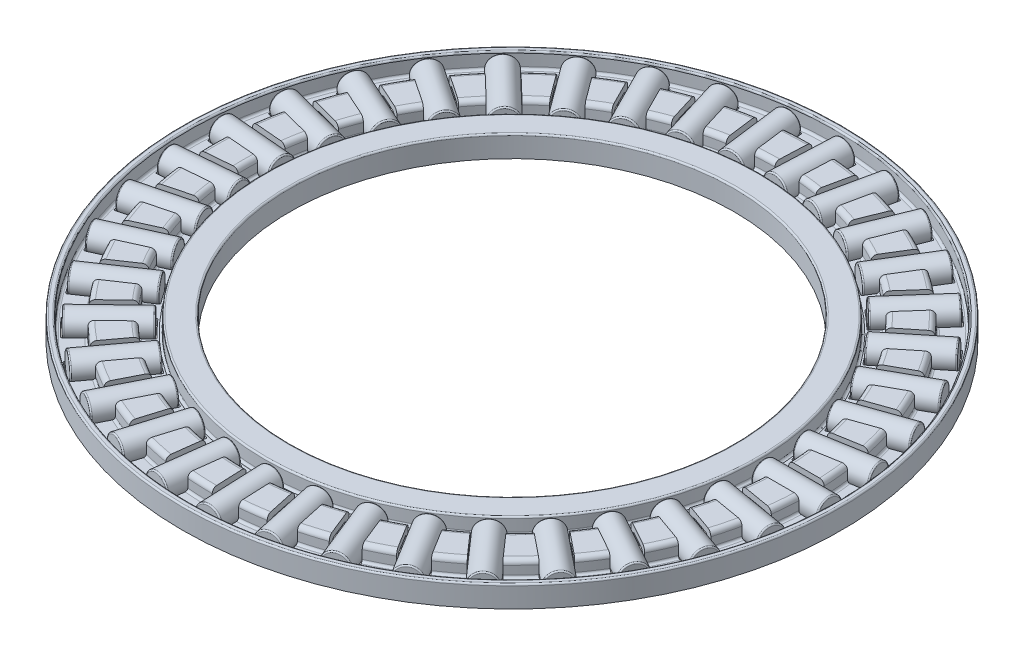
from build123d import *

# Parameters (mm, degrees)
FILLET1_R                = 0.369230769
FILLET2_R                = 0.369230769
FILLET3_R                = 0.125
FILLET4_R                = 0.184615385
CUT_EXTRUDE1_DEPTH       = 37.779376085
FILLET5_R                = 0.100026264
CIRPATTERN1_COUNT        = 37
FILLET5_OF_CIRPATTERN1_R = 0.100026264
SKETCH5_W                = 5.204168711
SKETCH5_H                = 1
FILLET6_R                = 0.100026264
CIRPATTERN2_COUNT        = 37


with BuildPart() as part:
    # Sketch3 → Revolve1 (revolve)
    with BuildSketch(Plane(origin=(0, 0, 0), x_dir=(0, 0, -1), z_dir=(1, 0, 0))):
        Polygon((18.183333333, -0.85), (18.183333333, 0.373397436), (18.841666667, 0.373397436), (18.841666667, -0.85), (21.331089744, -0.85), (21.331089744, 0.373397436), (23.17724359, 0.373397436), (23.17724359, -0.85), (25.666666667, -0.85), (25.666666667, 0.373397436), (25.833333333, 0.373397436), (25.833333333, -0.85), (26, -0.85), (26, 0.85), (25.5, 0.85), (25.5, -0.373397436), (23.653846154, -0.373397436), (23.653846154, 0.85), (20.854487179, 0.85), (20.854487179, -0.373397436), (19.5, -0.373397436), (19.5, 0.85), (17.525, 0.85), (17.525, -0.85), align=None)
    revolve(axis=Axis((0, 1, 0), (0, -1, 0)))

    # Fillet1
    fillet1_edges = [part.edges().sort_by_distance(p)[0] for p in [
        (0, -0.85, 23.17724359),
        (0, -0.85, 25.666666667),
        (0, -0.85, 18.841666667),
        (0, -0.85, 21.331089744),
    ]]
    fillet(fillet1_edges, radius=FILLET1_R)

    # Fillet2
    fillet2_edges = [part.edges().sort_by_distance(p)[0] for p in [
        (0, 0.85, 23.653846154),
        (0, 0.85, 20.854487179),
    ]]
    fillet(fillet2_edges, radius=FILLET2_R)

    # Fillet3
    fillet3_edges = [part.edges().sort_by_distance(p)[0] for p in [
        (0, 0.85, 25.5),
        (0, 0.85, 26),
        (0, 0.85, 19.5),
        (0, 0.85, 17.525),
    ]]
    fillet(fillet3_edges, radius=FILLET3_R)

    # Fillet4
    fillet4_edges = [part.edges().sort_by_distance(p)[0] for p in [
        (0, 0.373397436, 21.331089744),
        (0, 0.373397436, 23.17724359),
        (0, -0.373397436, 25.5),
        (0, -0.373397436, 23.653846154),
        (0, -0.373397436, 20.854487179),
        (0, -0.373397436, 19.5),
    ]]
    fillet(fillet4_edges, radius=FILLET4_R)

    # Sketch4 → Cut-Extrude1 (cut, symmetric)
    with BuildSketch(Plane(origin=(0, 0, 0), x_dir=(1, 0, 0), z_dir=(0, 1, 0))):
        with BuildLine():
            Line((19.774731351, 1), (25.180150913, 1))
            ThreePointArc((25.180150913, 1), (25.2, 0), (25.180150913, -1))
            Line((25.180150913, -1), (19.774731351, -1))
            ThreePointArc((19.774731351, -1), (19.8, 0), (19.774731351, 1))
        make_face()
    cut_extrude1 = extrude(amount=CUT_EXTRUDE1_DEPTH, both=True, mode=Mode.SUBTRACT)

    # Fillet5
    fillet5_edges = [part.edges().sort_by_distance(p)[0] for p in [
        (25.180150913, -0.611698718, -1),
        (25.180150913, -0.611698718, 1),
        (19.774731351, -0.611698718, -1),
        (19.774731351, -0.611698718, 1),
    ]]
    fillet(fillet5_edges, radius=FILLET5_R)

    # CirPattern1: Cut-Extrude1 ×37 about axis
    cirpattern1_axis = Axis((0, 1, 0), (0, -1, 0))
    for i in range(1, CIRPATTERN1_COUNT):
        add(cut_extrude1.rotate(cirpattern1_axis, i * 360 / CIRPATTERN1_COUNT), mode=Mode.SUBTRACT)

    # Fillet5 of CirPattern1
    fillet5_of_cirpattern1_edges = [part.edges().sort_by_distance(p)[0] for p in [
        (24.986958185, -0.611698718, 3.26985025),
        (24.648956544, -0.611698718, 5.24108207),
        (19.659290663, -0.611698718, 2.35632991),
        (19.321289022, -0.611698718, 4.32756173),
        (24.074936164, -0.611698718, 7.445632861),
        (23.408656574, -0.611698718, 9.331387752),
        (18.978287976, -0.611698718, 5.644872498),
        (18.312008386, -0.611698718, 7.530627389),
        (22.470322062, -0.611698718, 11.407218172),
        (21.494932175, -0.611698718, 13.153246398),
        (17.751314497, -0.611698718, 8.771022382),
        (16.775924609, -0.611698718, 10.517050608),
        (20.219277707, -0.611698718, 15.040638584),
        (18.962837712, -0.611698718, 16.596710093),
        (16.01366802, -0.611698718, 11.644845921),
        (14.757228026, -0.611698718, 13.20091743),
        (17.386561545, -0.611698718, 18.241367209),
        (15.885216934, -0.611698718, 19.562716656),
        (13.815337471, -0.611698718, 14.183668446),
        (12.31399286, -0.611698718, 15.505017892),
        (14.053665662, -0.611698718, 20.917324911),
        (12.350607387, -0.611698718, 21.965939478),
        (11.219564815, -0.611698718, 16.314452653),
        (9.51650654, -0.611698718, 17.36306722),
        (10.316471407, -0.611698718, 22.99152926),
        (8.460693352, -0.611698718, 23.737242216),
        (8.301025708, -0.611698718, 17.97589976),
        (6.445247653, -0.611698718, 18.721612716),
        (6.282491052, -0.611698718, 24.404309172),
        (4.327380574, -0.611698718, 24.825667712),
        (5.143681204, -0.611698718, 19.120212961),
        (3.188570726, -0.611698718, 19.541571501),
        (2.067774868, -0.611698718, 25.115021543),
        (0.069576935, -0.611698718, 25.199903949),
        (1.838362358, -0.611698718, 19.714472446),
        (-0.159835575, -0.611698718, 19.799354853),
        (-2.206427435, -0.611698718, 25.10322047),
        (-4.190228305, -0.611698718, 24.849184831),
        (-1.519842827, -0.611698718, 19.741582454),
        (-3.503643698, -0.611698718, 19.487546814),
        (-6.417154837, -0.611698718, 24.36924545),
        (-8.329488306, -0.611698718, 23.783599907),
        (-4.834324901, -0.611698718, 19.200763077),
        (-6.74665837, -0.611698718, 18.615117535),
        (-10.443272378, -0.611698718, 22.934211607),
        (-12.229124094, -0.611698718, 22.033804117),
        (-8.009732249, -0.611698718, 18.107572706),
        (-9.795583965, -0.611698718, 17.207165216),
        (-14.168955987, -0.611698718, 20.839402253),
        (-15.776950248, -0.611698718, 19.6501359),
        (-10.954714183, -0.611698718, 16.493460436),
        (-12.562708444, -0.611698718, 15.304194084),
        (-17.487024529, -0.611698718, 18.145081237),
        (-18.870902267, -0.611698718, 16.701169049),
        (-13.584548936, -0.611698718, 14.404861339),
        (-14.968426674, -0.611698718, 12.960949151),
        (-20.302023215, -0.611698718, 14.928759272),
        (-21.421972787, -0.611698718, 13.271739973),
        (-15.823580949, -0.611698718, 11.901860608),
        (-16.943530522, -0.611698718, 10.24484131),
        (-22.532969656, -0.611698718, 11.282964082),
        (-23.356772152, -0.611698718, 9.460507102),
        (-17.607397348, -0.611698718, 9.056465018),
        (-18.431199845, -0.611698718, 7.234008037),
        (-24.115683586, -0.611698718, 7.312578559),
        (-24.619639709, -0.611698718, 5.377112666),
        (-18.884680984, -0.611698718, 5.950531417),
        (-19.388637106, -0.611698718, 4.015065523),
        (-25.004633206, -0.611698718, 3.131823465),
        (-25.174245055, -0.611698718, 1.139028488),
        (-19.61868673, -0.611698718, 2.673411862),
        (-19.788298579, -0.611698718, 0.680616885),
        (-25.174245055, -0.611698718, -1.139028488),
        (-25.004633206, -0.611698718, -3.131823465),
        (-19.788298579, -0.611698718, -0.680616885),
        (-19.61868673, -0.611698718, -2.673411862),
        (-24.619639709, -0.611698718, -5.377112666),
        (-24.115683586, -0.611698718, -7.312578559),
        (-19.388637106, -0.611698718, -4.015065523),
        (-18.884680984, -0.611698718, -5.950531417),
        (-23.356772152, -0.611698718, -9.460507102),
        (-22.532969656, -0.611698718, -11.282964082),
        (-18.431199845, -0.611698718, -7.234008037),
        (-17.607397348, -0.611698718, -9.056465018),
        (-21.421972787, -0.611698718, -13.271739973),
        (-20.302023215, -0.611698718, -14.928759272),
        (-16.943530522, -0.611698718, -10.24484131),
        (-15.823580949, -0.611698718, -11.901860608),
        (-18.870902267, -0.611698718, -16.701169049),
        (-17.487024529, -0.611698718, -18.145081237),
        (-14.968426674, -0.611698718, -12.960949151),
        (-13.584548936, -0.611698718, -14.404861339),
        (-15.776950248, -0.611698718, -19.6501359),
        (-14.168955987, -0.611698718, -20.839402253),
        (-12.562708444, -0.611698718, -15.304194084),
        (-10.954714183, -0.611698718, -16.493460436),
        (-12.229124094, -0.611698718, -22.033804117),
        (-10.443272378, -0.611698718, -22.934211607),
        (-9.795583965, -0.611698718, -17.207165216),
        (-8.009732249, -0.611698718, -18.107572706),
        (-8.329488306, -0.611698718, -23.783599907),
        (-6.417154837, -0.611698718, -24.36924545),
        (-6.74665837, -0.611698718, -18.615117535),
        (-4.834324901, -0.611698718, -19.200763077),
        (-4.190228305, -0.611698718, -24.849184831),
        (-2.206427435, -0.611698718, -25.10322047),
        (-3.503643698, -0.611698718, -19.487546814),
        (-1.519842827, -0.611698718, -19.741582454),
        (0.069576935, -0.611698718, -25.199903949),
        (2.067774868, -0.611698718, -25.115021543),
        (-0.159835575, -0.611698718, -19.799354853),
        (1.838362358, -0.611698718, -19.714472446),
        (4.327380574, -0.611698718, -24.825667712),
        (6.282491052, -0.611698718, -24.404309172),
        (3.188570726, -0.611698718, -19.541571501),
        (5.143681204, -0.611698718, -19.120212961),
        (8.460693352, -0.611698718, -23.737242216),
        (10.316471407, -0.611698718, -22.99152926),
        (6.445247653, -0.611698718, -18.721612716),
        (8.301025708, -0.611698718, -17.97589976),
        (12.350607387, -0.611698718, -21.965939478),
        (14.053665662, -0.611698718, -20.917324911),
        (9.51650654, -0.611698718, -17.36306722),
        (11.219564815, -0.611698718, -16.314452653),
        (15.885216934, -0.611698718, -19.562716656),
        (17.386561545, -0.611698718, -18.241367209),
        (12.31399286, -0.611698718, -15.505017892),
        (13.815337471, -0.611698718, -14.183668446),
        (18.962837712, -0.611698718, -16.596710093),
        (20.219277707, -0.611698718, -15.040638584),
        (14.757228026, -0.611698718, -13.20091743),
        (16.01366802, -0.611698718, -11.644845921),
        (21.494932175, -0.611698718, -13.153246398),
        (22.470322062, -0.611698718, -11.407218172),
        (16.775924609, -0.611698718, -10.517050608),
        (17.751314497, -0.611698718, -8.771022382),
        (23.408656574, -0.611698718, -9.331387752),
        (24.074936164, -0.611698718, -7.445632861),
        (18.312008386, -0.611698718, -7.530627389),
        (18.978287976, -0.611698718, -5.644872498),
        (24.648956544, -0.611698718, -5.24108207),
        (24.986958185, -0.611698718, -3.26985025),
        (19.321289022, -0.611698718, -4.32756173),
        (19.659290663, -0.611698718, -2.35632991),
    ]]
    fillet(fillet5_of_cirpattern1_edges, radius=FILLET5_OF_CIRPATTERN1_R)


with BuildPart() as body_2:
    # Sketch5 → Revolve2 (revolve)
    with BuildSketch(Plane(origin=(0, 0, 0), x_dir=(1, 0, 0), z_dir=(0, 1, 0))):
        with Locations((22.481749659, 0.5)):
            Rectangle(SKETCH5_W, SKETCH5_H)
    revolve(axis=Axis((25.2, 0, 0), (-1, 0, 0)))

    # Fillet6
    fillet6_edges = [body_2.edges().sort_by_distance(p)[0] for p in [
        (19.879665303, 0, 1),
        (25.083834014, 0, 1),
    ]]
    fillet(fillet6_edges, radius=FILLET6_R)


with BuildPart() as cirpattern2_1:
    # CirPattern2: pattern copy
    add(body_2.part.rotate(Axis((0, 1, 0), (0, -1, 0)), 1 * 360 / CIRPATTERN2_COUNT))


with BuildPart() as cirpattern2_2:
    # CirPattern2: pattern copy
    add(body_2.part.rotate(Axis((0, 1, 0), (0, -1, 0)), 2 * 360 / CIRPATTERN2_COUNT))


with BuildPart() as cirpattern2_3:
    # CirPattern2: pattern copy
    add(body_2.part.rotate(Axis((0, 1, 0), (0, -1, 0)), 3 * 360 / CIRPATTERN2_COUNT))


with BuildPart() as cirpattern2_4:
    # CirPattern2: pattern copy
    add(body_2.part.rotate(Axis((0, 1, 0), (0, -1, 0)), 4 * 360 / CIRPATTERN2_COUNT))


with BuildPart() as cirpattern2_5:
    # CirPattern2: pattern copy
    add(body_2.part.rotate(Axis((0, 1, 0), (0, -1, 0)), 5 * 360 / CIRPATTERN2_COUNT))


with BuildPart() as cirpattern2_6:
    # CirPattern2: pattern copy
    add(body_2.part.rotate(Axis((0, 1, 0), (0, -1, 0)), 6 * 360 / CIRPATTERN2_COUNT))


with BuildPart() as cirpattern2_7:
    # CirPattern2: pattern copy
    add(body_2.part.rotate(Axis((0, 1, 0), (0, -1, 0)), 7 * 360 / CIRPATTERN2_COUNT))


with BuildPart() as cirpattern2_8:
    # CirPattern2: pattern copy
    add(body_2.part.rotate(Axis((0, 1, 0), (0, -1, 0)), 8 * 360 / CIRPATTERN2_COUNT))


with BuildPart() as cirpattern2_9:
    # CirPattern2: pattern copy
    add(body_2.part.rotate(Axis((0, 1, 0), (0, -1, 0)), 9 * 360 / CIRPATTERN2_COUNT))


with BuildPart() as cirpattern2_10:
    # CirPattern2: pattern copy
    add(body_2.part.rotate(Axis((0, 1, 0), (0, -1, 0)), 10 * 360 / CIRPATTERN2_COUNT))


with BuildPart() as cirpattern2_11:
    # CirPattern2: pattern copy
    add(body_2.part.rotate(Axis((0, 1, 0), (0, -1, 0)), 11 * 360 / CIRPATTERN2_COUNT))


with BuildPart() as cirpattern2_12:
    # CirPattern2: pattern copy
    add(body_2.part.rotate(Axis((0, 1, 0), (0, -1, 0)), 12 * 360 / CIRPATTERN2_COUNT))


with BuildPart() as cirpattern2_13:
    # CirPattern2: pattern copy
    add(body_2.part.rotate(Axis((0, 1, 0), (0, -1, 0)), 13 * 360 / CIRPATTERN2_COUNT))


with BuildPart() as cirpattern2_14:
    # CirPattern2: pattern copy
    add(body_2.part.rotate(Axis((0, 1, 0), (0, -1, 0)), 14 * 360 / CIRPATTERN2_COUNT))


with BuildPart() as cirpattern2_15:
    # CirPattern2: pattern copy
    add(body_2.part.rotate(Axis((0, 1, 0), (0, -1, 0)), 15 * 360 / CIRPATTERN2_COUNT))


with BuildPart() as cirpattern2_16:
    # CirPattern2: pattern copy
    add(body_2.part.rotate(Axis((0, 1, 0), (0, -1, 0)), 16 * 360 / CIRPATTERN2_COUNT))


with BuildPart() as cirpattern2_17:
    # CirPattern2: pattern copy
    add(body_2.part.rotate(Axis((0, 1, 0), (0, -1, 0)), 17 * 360 / CIRPATTERN2_COUNT))


with BuildPart() as cirpattern2_18:
    # CirPattern2: pattern copy
    add(body_2.part.rotate(Axis((0, 1, 0), (0, -1, 0)), 18 * 360 / CIRPATTERN2_COUNT))


with BuildPart() as cirpattern2_19:
    # CirPattern2: pattern copy
    add(body_2.part.rotate(Axis((0, 1, 0), (0, -1, 0)), 19 * 360 / CIRPATTERN2_COUNT))


with BuildPart() as cirpattern2_20:
    # CirPattern2: pattern copy
    add(body_2.part.rotate(Axis((0, 1, 0), (0, -1, 0)), 20 * 360 / CIRPATTERN2_COUNT))


with BuildPart() as cirpattern2_21:
    # CirPattern2: pattern copy
    add(body_2.part.rotate(Axis((0, 1, 0), (0, -1, 0)), 21 * 360 / CIRPATTERN2_COUNT))


with BuildPart() as cirpattern2_22:
    # CirPattern2: pattern copy
    add(body_2.part.rotate(Axis((0, 1, 0), (0, -1, 0)), 22 * 360 / CIRPATTERN2_COUNT))


with BuildPart() as cirpattern2_23:
    # CirPattern2: pattern copy
    add(body_2.part.rotate(Axis((0, 1, 0), (0, -1, 0)), 23 * 360 / CIRPATTERN2_COUNT))


with BuildPart() as cirpattern2_24:
    # CirPattern2: pattern copy
    add(body_2.part.rotate(Axis((0, 1, 0), (0, -1, 0)), 24 * 360 / CIRPATTERN2_COUNT))


with BuildPart() as cirpattern2_25:
    # CirPattern2: pattern copy
    add(body_2.part.rotate(Axis((0, 1, 0), (0, -1, 0)), 25 * 360 / CIRPATTERN2_COUNT))


with BuildPart() as cirpattern2_26:
    # CirPattern2: pattern copy
    add(body_2.part.rotate(Axis((0, 1, 0), (0, -1, 0)), 26 * 360 / CIRPATTERN2_COUNT))


with BuildPart() as cirpattern2_27:
    # CirPattern2: pattern copy
    add(body_2.part.rotate(Axis((0, 1, 0), (0, -1, 0)), 27 * 360 / CIRPATTERN2_COUNT))


with BuildPart() as cirpattern2_28:
    # CirPattern2: pattern copy
    add(body_2.part.rotate(Axis((0, 1, 0), (0, -1, 0)), 28 * 360 / CIRPATTERN2_COUNT))


with BuildPart() as cirpattern2_29:
    # CirPattern2: pattern copy
    add(body_2.part.rotate(Axis((0, 1, 0), (0, -1, 0)), 29 * 360 / CIRPATTERN2_COUNT))


with BuildPart() as cirpattern2_30:
    # CirPattern2: pattern copy
    add(body_2.part.rotate(Axis((0, 1, 0), (0, -1, 0)), 30 * 360 / CIRPATTERN2_COUNT))


with BuildPart() as cirpattern2_31:
    # CirPattern2: pattern copy
    add(body_2.part.rotate(Axis((0, 1, 0), (0, -1, 0)), 31 * 360 / CIRPATTERN2_COUNT))


with BuildPart() as cirpattern2_32:
    # CirPattern2: pattern copy
    add(body_2.part.rotate(Axis((0, 1, 0), (0, -1, 0)), 32 * 360 / CIRPATTERN2_COUNT))


with BuildPart() as cirpattern2_33:
    # CirPattern2: pattern copy
    add(body_2.part.rotate(Axis((0, 1, 0), (0, -1, 0)), 33 * 360 / CIRPATTERN2_COUNT))


with BuildPart() as cirpattern2_34:
    # CirPattern2: pattern copy
    add(body_2.part.rotate(Axis((0, 1, 0), (0, -1, 0)), 34 * 360 / CIRPATTERN2_COUNT))


with BuildPart() as cirpattern2_35:
    # CirPattern2: pattern copy
    add(body_2.part.rotate(Axis((0, 1, 0), (0, -1, 0)), 35 * 360 / CIRPATTERN2_COUNT))


with BuildPart() as cirpattern2_36:
    # CirPattern2: pattern copy
    add(body_2.part.rotate(Axis((0, 1, 0), (0, -1, 0)), 36 * 360 / CIRPATTERN2_COUNT))


solid = Compound([part.part, body_2.part, cirpattern2_1.part, cirpattern2_2.part, cirpattern2_3.part, cirpattern2_4.part, cirpattern2_5.part, cirpattern2_6.part, cirpattern2_7.part, cirpattern2_8.part, cirpattern2_9.part, cirpattern2_10.part, cirpattern2_11.part, cirpattern2_12.part, cirpattern2_13.part, cirpattern2_14.part, cirpattern2_15.part, cirpattern2_16.part, cirpattern2_17.part, cirpattern2_18.part, cirpattern2_19.part, cirpattern2_20.part, cirpattern2_21.part, cirpattern2_22.part, cirpattern2_23.part, cirpattern2_24.part, cirpattern2_25.part, cirpattern2_26.part, cirpattern2_27.part, cirpattern2_28.part, cirpattern2_29.part, cirpattern2_30.part, cirpattern2_31.part, cirpattern2_32.part, cirpattern2_33.part, cirpattern2_34.part, cirpattern2_35.part, cirpattern2_36.part])
